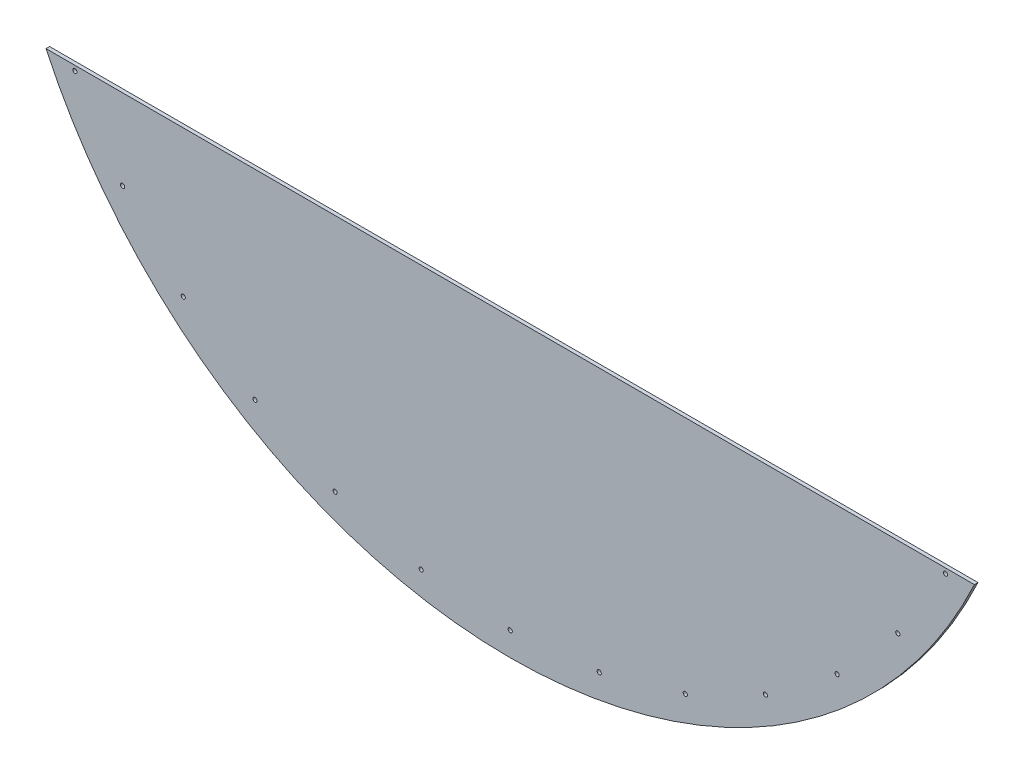
from build123d import *

# Parameters (mm, degrees)
BASE_FLANGE1_DEPTH              = 6
SKETCH2_W                       = 1968.518691842
SKETCH2_H                       = 782.123286761
CUT_EXTRUDE1_DEPTH              = 10
SKETCH3_R                       = 3.5
CUT_EXTRUDE2_DEPTH              = 10
CIRPATTERN4_COUNT               = 7
CIRPATTERN4_ANGLE               = 63
CIRPATTERN4_THE_OTHER_WAY_COUNT = 7
CIRPATTERN4_THE_OTHER_WAY_ANGLE = 63


# Sheet-metal steps are written as plain solids
with BuildPart() as part:
    # Sketch1 → Base-Flange1 (new body)
    with BuildSketch(Plane.XY):
        with BuildLine():
            Line((859.985464993, -5), (-859.985464993, -5))
            ThreePointArc((-859.985464993, -5), (0, -860), (859.985464993, -5))
        make_face()
    extrude(amount=-BASE_FLANGE1_DEPTH)

    # Sketch2 → Cut-Extrude1 (cut)
    with BuildSketch(Plane.XY):
        with Locations((10.387961435, 27.061643381)):
            Rectangle(SKETCH2_W, SKETCH2_H)
    extrude(amount=-CUT_EXTRUDE1_DEPTH, mode=Mode.SUBTRACT)

    # Sketch3 → Cut-Extrude2 (cut)
    with BuildSketch(Plane(origin=(0, 0, -6), x_dir=(-1, 0, 0), z_dir=(0, 0, -1))):
        with Locations((0, -820)):
            Circle(SKETCH3_R)
    cut_extrude2 = extrude(amount=-CUT_EXTRUDE2_DEPTH, mode=Mode.SUBTRACT)

    # CirPattern4: Cut-Extrude2 ×7 about axis
    cirpattern4_axis = Axis((0, 0, 0), (0, 0, 1))
    for i in range(1, CIRPATTERN4_COUNT):
        add(cut_extrude2.rotate(cirpattern4_axis, i * CIRPATTERN4_ANGLE / (CIRPATTERN4_COUNT - 1)), mode=Mode.SUBTRACT)

    # CirPattern4 the other way: Cut-Extrude2 ×7 about axis
    cirpattern4_the_other_way_axis = Axis((0, 0, 0), (0, 0, -1))
    for i in range(1, CIRPATTERN4_THE_OTHER_WAY_COUNT):
        add(cut_extrude2.rotate(cirpattern4_the_other_way_axis, i * CIRPATTERN4_THE_OTHER_WAY_ANGLE / (CIRPATTERN4_THE_OTHER_WAY_COUNT - 1)), mode=Mode.SUBTRACT)


solid = part.part
